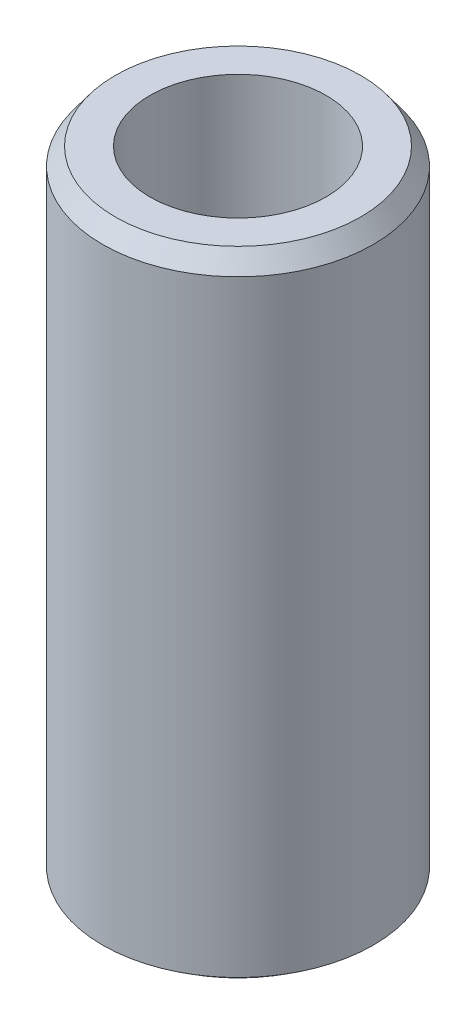
from build123d import *
from OCP.BRepFilletAPI import BRepFilletAPI_MakeChamfer

# Parameters (mm, degrees)
SKETCH1_R           = 17.5
BOSS_EXTRUDE1_DEPTH = 82.323503467
SKETCH2_R           = 11.383306922
CUT_EXTRUDE1_DEPTH  = 86.963127114
CHAMFER1_SIZE       = 2.250000403
CHAMFER1_SIZE2      = 1.642773282


with BuildPart() as part:
    # Sketch1 → Boss-Extrude1 (new body)
    with BuildSketch(Plane(origin=(0, 0, 0), x_dir=(1, 0, 0), z_dir=(0, 1, 0))):
        Circle(SKETCH1_R)
    extrude(amount=BOSS_EXTRUDE1_DEPTH)

    # Sketch2 → Cut-Extrude1 (cut, through all)
    with BuildSketch(Plane(origin=(0, 0, 0), x_dir=(1, 0, 0), z_dir=(0, 1, 0))):
        Circle(SKETCH2_R)
    extrude(amount=CUT_EXTRUDE1_DEPTH, mode=Mode.SUBTRACT)

    # Chamfer1: one chamfer whose edges measure the first distance from different faces: ONE call of the kernel's chamfer builder (chamfer() names one face for all edges)
    chamfer1_edges_1 = [part.edges().sort_by_distance(p)[0] for p in [
        (-17.5, 82.323503467, 0),
    ]]
    chamfer1_side_1 = [part.faces().sort_by_distance(p)[0] for p in [
        (-17.5, 41.161751734, 0),
    ]]
    chamfer1_edges_2 = [part.edges().sort_by_distance(p)[0] for p in [
        (-17.5, 0, 0),
    ]]
    chamfer1_side_2 = [part.faces().sort_by_distance(p)[0] for p in [
        (-17.005025253, 0, 0),
    ]]
    chamfer1 = BRepFilletAPI_MakeChamfer(part.part.solid().wrapped)
    for e in chamfer1_edges_1:
        chamfer1.Add(CHAMFER1_SIZE, CHAMFER1_SIZE2, e.wrapped, chamfer1_side_1[0].wrapped)  # the first distance lies on this face
    for e in chamfer1_edges_2:
        chamfer1.Add(CHAMFER1_SIZE, CHAMFER1_SIZE2, e.wrapped, chamfer1_side_2[0].wrapped)  # the first distance lies on this face
    add(Compound.cast(chamfer1.Shape()), mode=Mode.REPLACE)


solid = part.part
